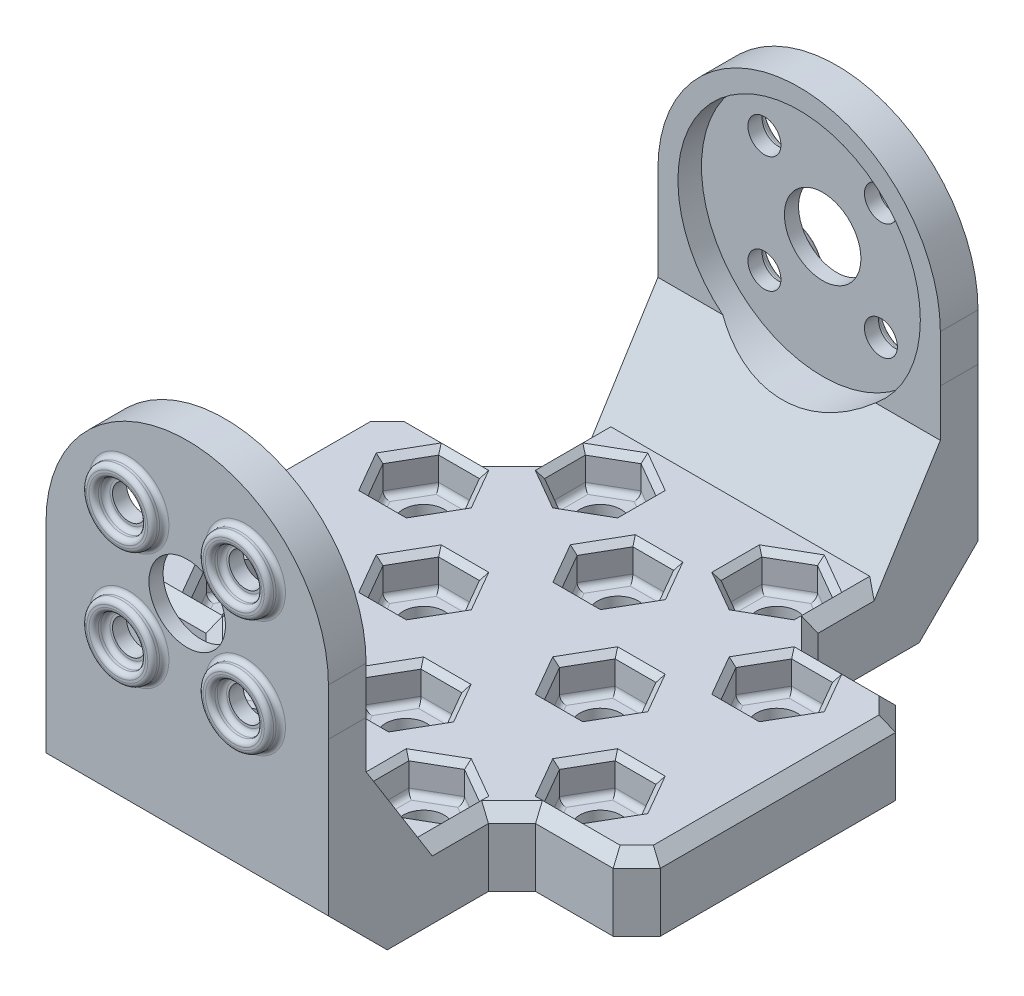
from build123d import *

# Parameters (mm, degrees)
SKETCH_1_R          = 3.25
SKETCH_1_R_2        = 1.4
EXTRUDE_1_DEPTH     = 3.2
SKETCH_2_W          = 24
SKETCH_2_H          = 6
EXTRUDE_2_DEPTH     = 48.8
SKETCH_3_R          = 1.4
SKETCH_3_R_2        = 3.25
EXTRUDE_3_DEPTH     = 3.2
SKETCH_4_R          = 10.3
CUT_EXTRUDE_1_DEPTH = 2
CUT_EXTRUDE_START   = -2
SKETCH_5_R          = 10.3
CUT_EXTRUDE_2_DEPTH = 2
CHAMFER_1_SIZE      = 5
SKETCH_6_R          = 3
SKETCH_6_R_2        = 2
EXTRUDE_4_DEPTH     = 1
EXTRUDE_START       = 1
SKETCH_7_R          = 3
SKETCH_7_R_2        = 2
EXTRUDE_5_DEPTH     = 1
FILLET_1_R          = 0.4
CHAMFER_4_SIZE      = 5
CHAMFER_4_SIZE_2    = 8
CHAMFER_5_SIZE      = 5
CHAMFER_5_SIZE_2    = 8
SKETCH_8_W          = 10.6001
SKETCH_8_H          = 24
EXTRUDE_6_DEPTH     = 6
CHAMFER_6_SIZE      = 2
CHAMFER_7_SIZE      = 1
SKETCH_9_R          = 1.75
CUT_EXTRUDE_3_DEPTH = 6
CUT_EXTRUDE_4_DEPTH = 3
CHAMFER_8_SIZE      = 0.5
FILLET_2_R          = 0.5


# Some blends are built 0.0001 mm under size
with BuildPart() as part:
    # Эскиз1 → Бобышка-Вытянуть1 (new body)
    with BuildSketch(Plane.XY):
        with BuildLine():
            Line((-11.9999, -22), (-11.9999, -16))
            Line((-11.9999, -16), (-12, -7.5e-05))
            ThreePointArc((-12, -7.5e-05), (-0.000187494, 11.999999999), (11.999999996, 0.000299989))
            Line((11.999999996, 0.000299989), (12.0001, -4))
            Line((12.0001, -4), (12.0001, -22))
            Line((12.0001, -22), (-11.9999, -22))
        make_face()
        Circle(SKETCH_1_R, mode=Mode.SUBTRACT)
        with Locations((-4.949747468, 4.949747468)):
            Circle(SKETCH_1_R_2, mode=Mode.SUBTRACT)
        with Locations((4.949747468, 4.949747468)):
            Circle(SKETCH_1_R_2, mode=Mode.SUBTRACT)
        with Locations((4.949747468, -4.949747468)):
            Circle(SKETCH_1_R_2, mode=Mode.SUBTRACT)
        with Locations((-4.949747468, -4.949747468)):
            Circle(SKETCH_1_R_2, mode=Mode.SUBTRACT)
    extrude(amount=EXTRUDE_1_DEPTH)

    # Эскиз2 → Бобышка-Вытянуть2 (add)
    with BuildSketch(Plane.XY.offset(3.2)):
        with Locations((0.0001, -19)):
            Rectangle(SKETCH_2_W, SKETCH_2_H)
    extrude(amount=EXTRUDE_2_DEPTH)

    # Эскиз3 → Бобышка-Вытянуть3 (add)
    with BuildSketch(Plane.XY.offset(52)):
        with BuildLine():
            Line((-11.9999, -22), (12.0001, -22))
            Line((12.0001, -22), (12.0001, -4))
            Line((12.0001, -4), (11.999999996, 0.000299989))
            ThreePointArc((11.999999996, 0.000299989), (-0.000187494, 11.999999999), (-12, -7.5e-05))
            Line((-12, -7.5e-05), (-11.9999, -16))
            Line((-11.9999, -16), (-11.9999, -22))
        make_face()
        with Locations((-4.949747468, 4.949747468)):
            Circle(SKETCH_3_R, mode=Mode.SUBTRACT)
        Circle(SKETCH_3_R_2, mode=Mode.SUBTRACT)
        with Locations((-4.949747468, -4.949747468)):
            Circle(SKETCH_3_R, mode=Mode.SUBTRACT)
        with Locations((4.949747468, -4.949747468)):
            Circle(SKETCH_3_R, mode=Mode.SUBTRACT)
        with Locations((4.949747468, 4.949747468)):
            Circle(SKETCH_3_R, mode=Mode.SUBTRACT)
    extrude(amount=EXTRUDE_3_DEPTH)

    # Эскиз4 → Вырез-Вытянуть1 (cut)
    with BuildSketch(Plane.XY.offset(3.2)):
        Circle(SKETCH_4_R)
    extrude(amount=-CUT_EXTRUDE_1_DEPTH, mode=Mode.SUBTRACT)

    # Эскиз5 → Вырез-Вытянуть2 (cut)
    with BuildSketch(Plane(origin=(0, 0, 52), x_dir=(-1, 0, 0), z_dir=(0, 0, -1)).offset(CUT_EXTRUDE_START)):
        with Locations(Location((0, 0, 0), (0, 0, 180))):
            Circle(SKETCH_5_R)
    extrude(amount=CUT_EXTRUDE_2_DEPTH, mode=Mode.SUBTRACT)

    # Фаска1
    chamfer_1_edges = [part.edges().sort_by_distance(p)[0] for p in [
        (0.0001, -22, 55.2),
        (0.0001, -22, 0),
    ]]
    chamfer(chamfer_1_edges, length=CHAMFER_1_SIZE)

    # Эскиз6 → Бобышка-Вытянуть4 (add)
    # profile 1 of 4: a face of its own
    with BuildSketch(Plane.XY.offset(55.2)):
        with Locations((-4.949747468, 4.949747468)):
            Circle(SKETCH_6_R)
        with Locations((-4.949747468, 4.949747468)):
            Circle(SKETCH_6_R_2, mode=Mode.SUBTRACT)
    # profile 2 of 4: a face of its own
    with BuildSketch(Plane.XY.offset(55.2)):
        with Locations((4.949747468, -4.949747468)):
            Circle(SKETCH_6_R)
        with Locations((4.949747468, -4.949747468)):
            Circle(SKETCH_6_R_2, mode=Mode.SUBTRACT)
    # profile 3 of 4: a face of its own
    with BuildSketch(Plane.XY.offset(55.2)):
        with Locations((-4.949747468, -4.949747468)):
            Circle(SKETCH_6_R)
        with Locations((-4.949747468, -4.949747468)):
            Circle(SKETCH_6_R_2, mode=Mode.SUBTRACT)
    # profile 4 of 4: a face of its own
    with BuildSketch(Plane.XY.offset(55.2)):
        with Locations((4.949747468, 4.949747468)):
            Circle(SKETCH_6_R)
        with Locations((4.949747468, 4.949747468)):
            Circle(SKETCH_6_R_2, mode=Mode.SUBTRACT)
    extrude(amount=EXTRUDE_4_DEPTH)

    # Эскиз7 → Бобышка-Вытянуть5 (add)
    # profile 1 of 4: a face of its own
    with BuildSketch(Plane(origin=(0, 0, 0), x_dir=(-1, 0, 0), z_dir=(0, 0, -1)).offset(EXTRUDE_START)):
        with Locations(Location((4.949747468, -4.949747468, 0), (0, 0, 180))):
            Circle(SKETCH_7_R)
        with Locations(Location((4.949747468, -4.949747468, 0), (0, 0, 180))):
            Circle(SKETCH_7_R_2, mode=Mode.SUBTRACT)
    # profile 2 of 4: a face of its own
    with BuildSketch(Plane(origin=(0, 0, 0), x_dir=(-1, 0, 0), z_dir=(0, 0, -1)).offset(EXTRUDE_START)):
        with Locations(Location((4.949747468, 4.949747468, 0), (0, 0, 180))):
            Circle(SKETCH_7_R)
        with Locations(Location((4.949747468, 4.949747468, 0), (0, 0, 180))):
            Circle(SKETCH_7_R_2, mode=Mode.SUBTRACT)
    # profile 3 of 4: a face of its own
    with BuildSketch(Plane(origin=(0, 0, 0), x_dir=(-1, 0, 0), z_dir=(0, 0, -1)).offset(EXTRUDE_START)):
        with Locations(Location((-4.949747468, 4.949747468, 0), (0, 0, 180))):
            Circle(SKETCH_7_R)
        with Locations(Location((-4.949747468, 4.949747468, 0), (0, 0, 180))):
            Circle(SKETCH_7_R_2, mode=Mode.SUBTRACT)
    # profile 4 of 4: a face of its own
    with BuildSketch(Plane(origin=(0, 0, 0), x_dir=(-1, 0, 0), z_dir=(0, 0, -1)).offset(EXTRUDE_START)):
        with Locations(Location((-4.949747468, -4.949747468, 0), (0, 0, 180))):
            Circle(SKETCH_7_R)
        with Locations(Location((-4.949747468, -4.949747468, 0), (0, 0, 180))):
            Circle(SKETCH_7_R_2, mode=Mode.SUBTRACT)
    extrude(amount=-EXTRUDE_5_DEPTH)

    # Скругление1
    fillet_1_edges = [part.edges().sort_by_distance(p)[0] for p in [
        (-6.949747468, 4.949747468, 55.2),
        (-7.949747468, 4.949747468, 56.2),
        (-7.949747468, 4.949747468, 55.2),
        (-6.949747468, 4.949747468, 56.2),
        (2.949747468, -4.949747468, 55.2),
        (1.949747468, -4.949747468, 56.2),
        (1.949747468, -4.949747468, 55.2),
        (2.949747468, -4.949747468, 56.2),
        (-6.949747468, -4.949747468, 55.2),
        (-7.949747468, -4.949747468, 56.2),
        (-7.949747468, -4.949747468, 55.2),
        (-6.949747468, -4.949747468, 56.2),
        (2.949747468, 4.949747468, 55.2),
        (1.949747468, 4.949747468, 56.2),
        (1.949747468, 4.949747468, 55.2),
        (2.949747468, 4.949747468, 56.2),
        (-7.949747468, -4.949747468, 0),
        (-7.949747468, -4.949747468, -1),
        (-6.949747468, -4.949747468, 0),
        (-6.949747468, -4.949747468, -1),
        (-7.949747468, 4.949747468, 0),
        (-7.949747468, 4.949747468, -1),
        (-6.949747468, 4.949747468, 0),
        (-6.949747468, 4.949747468, -1),
        (1.949747468, 4.949747468, 0),
        (1.949747468, 4.949747468, -1),
        (2.949747468, 4.949747468, 0),
        (2.949747468, 4.949747468, -1),
        (1.949747468, -4.949747468, 0),
        (1.949747468, -4.949747468, -1),
        (2.949747468, -4.949747468, 0),
        (2.949747468, -4.949747468, -1),
    ]]
    fillet(fillet_1_edges, radius=FILLET_1_R)

    # Фаска4
    # the kernel refuses this chamfer: 8, 5 mm, written as the material it adds along each edge
    with BuildSketch(Plane(origin=(-32.682645121, -16, 3.2), x_dir=(0, -0.05241922030434533, 0.9986251675892635), z_dir=(1, 0, 0))) as chamfer_4_piece_1_section:
        Polygon((CHAMFER_4_SIZE * 0.998625167589, -CHAMFER_4_SIZE * 0.0524192203043), (-CHAMFER_4_SIZE_2 * 0.0524192203043, -CHAMFER_4_SIZE_2 * 0.998625167589), (0, 0), align=None)
    chamfer_4_piece_1 = extrude(amount=44.682745121, mode=Mode.PRIVATE)
    chamfer_4_piece_1 = split(chamfer_4_piece_1, bisect_by=Plane(origin=(-11.999925, -11.999995619, 4.449998631), z_dir=(0.9999999999804687, 6.2500146490708725e-06, 0)), keep=Keep.TOP, mode=Mode.PRIVATE)
    chamfer_4_piece_1 = chamfer_4_piece_1 - Plane(origin=(0, 0, 4.449998631), x_dir=(1, 0, 0), z_dir=(0, 0, 1)) * Cylinder(10.3, 122, mode=Mode.PRIVATE)
    add(chamfer_4_piece_1)

    # Фаска5
    # the kernel refuses this chamfer: 8, 5 mm, written as the material it adds along each edge
    with BuildSketch(Plane(origin=(-32.682645121, -16, 52), x_dir=(0, -0.0524192203043453, -0.9986251675892635), z_dir=(1, 0, 0))) as chamfer_5_piece_1_section:
        Polygon((CHAMFER_5_SIZE * 0.998625167589, CHAMFER_5_SIZE * 0.0524192203043), (-CHAMFER_5_SIZE_2 * 0.0524192203043, CHAMFER_5_SIZE_2 * 0.998625167589), (0, 0), align=None)
    chamfer_5_piece_1 = extrude(amount=44.682745121, mode=Mode.PRIVATE)
    chamfer_5_piece_1 = split(chamfer_5_piece_1, bisect_by=Plane(origin=(-11.999925, -12.000007302, 50.749997718), z_dir=(0.9999999999804687, 6.2500146490708725e-06, 0)), keep=Keep.TOP, mode=Mode.PRIVATE)
    chamfer_5_piece_1 = chamfer_5_piece_1 - Plane(origin=(0, 0, 50.749997718), x_dir=(1, 0, 0), z_dir=(0, 0, 1)) * Cylinder(10.3, 122, mode=Mode.PRIVATE)
    add(chamfer_5_piece_1)

    # Эскиз8 → Бобышка-Вытянуть6 (add)
    with BuildSketch(Plane.XZ.offset(22)):
        with Locations((-17.29995, 27.6)):
            Rectangle(SKETCH_8_W, SKETCH_8_H)
        with Locations((17.30015, 27.6)):
            Rectangle(SKETCH_8_W, SKETCH_8_H)
    extrude(amount=-EXTRUDE_6_DEPTH)

    # Фаска6
    chamfer_6_edges = [part.edges().sort_by_distance(p)[0] for p in [
        (12.0001, -19, 39.6),
        (12.0001, -19, 15.6),
        (-11.9999, -19, 15.6),
        (-11.9999, -19, 39.6),
        (-22.6, -19, 39.6),
        (-22.6, -19, 15.6),
        (22.6002, -19, 15.6),
        (22.6002, -19, 39.6),
    ]]
    chamfer(chamfer_6_edges, length=CHAMFER_6_SIZE)

    # Фаска7
    # the kernel refuses this chamfer: 1 mm, written as the material it takes off along each edge
    with BuildSketch(Plane(origin=(12.0001, -16, 39.028317012), x_dir=(-0.9996219169112968, 0.027495876610585647, 0), z_dir=(0, 0, 1))) as chamfer_7_piece_1_section:
        Polygon((CHAMFER_7_SIZE * 0.999621916911, CHAMFER_7_SIZE * 0.0274958766106), (-CHAMFER_7_SIZE * 0.0274958766106, CHAMFER_7_SIZE * 0.999621916911), (0, 0), align=None)
    chamfer_7_piece_1 = extrude(amount=10.543365976, mode=Mode.PRIVATE)
    chamfer_7_piece_1 = split(chamfer_7_piece_1, bisect_by=Plane(origin=(11.678999598, -17.42378565, 46.110133969), z_dir=(0, 0.5299989400034341, -0.8479983040049294)), keep=Keep.TOP, mode=Mode.PRIVATE)
    chamfer_7_piece_1 = split(chamfer_7_piece_1, bisect_by=Plane(origin=(10.460620554, -16.328613475, 43.139479446), z_dir=(0.7071067811865476, 0, 0.7071067811865476)), keep=Keep.TOP, mode=Mode.PRIVATE)
    add(chamfer_7_piece_1, mode=Mode.SUBTRACT)
    with BuildSketch(Plane(origin=(-11.9999, -16, 39.028317012), x_dir=(0.9996219169112968, 0.027495876610585647, 0), z_dir=(0, 0, 1))) as chamfer_7_piece_2_section:
        Polygon((CHAMFER_7_SIZE * 0.999621916911, -CHAMFER_7_SIZE * 0.0274958766106), (-CHAMFER_7_SIZE * 0.0274958766106, -CHAMFER_7_SIZE * 0.999621916911), (0, 0), align=None)
    chamfer_7_piece_2 = extrude(amount=10.543365976, mode=Mode.PRIVATE)
    chamfer_7_piece_2 = split(chamfer_7_piece_2, bisect_by=Plane(origin=(-11.678799598, -17.42378565, 46.110133969), z_dir=(0, 0.5299989400034341, -0.8479983040049294)), keep=Keep.TOP, mode=Mode.PRIVATE)
    chamfer_7_piece_2 = split(chamfer_7_piece_2, bisect_by=Plane(origin=(-10.460420554, -16.328613475, 43.139479446), z_dir=(-0.7071067811865476, 0, 0.7071067811865476)), keep=Keep.TOP, mode=Mode.PRIVATE)
    add(chamfer_7_piece_2, mode=Mode.SUBTRACT)
    with BuildSketch(Plane(origin=(11.428417012, -16, 39.6), x_dir=(0, 0.02749587661058555, -0.9996219169112968), z_dir=(1, 0, 0))) as chamfer_7_piece_3_section:
        Polygon((CHAMFER_7_SIZE * 0.999621916911, -CHAMFER_7_SIZE * 0.0274958766106), (-CHAMFER_7_SIZE * 0.0274958766106, -CHAMFER_7_SIZE * 0.999621916911), (0, 0), align=None)
    chamfer_7_piece_3 = extrude(amount=11.743465976, mode=Mode.PRIVATE)
    chamfer_7_piece_3 = split(chamfer_7_piece_3, bisect_by=Plane(origin=(16.53500452, -16.333633117, 37.06509548), z_dir=(0.7071067811865476, 0, 0.7071067811865476)), keep=Keep.TOP, mode=Mode.PRIVATE)
    add(chamfer_7_piece_3, mode=Mode.SUBTRACT)
    with BuildSketch(Plane(origin=(12.0001, -16, 5.628317012), x_dir=(-0.9996219169112968, 0.027495876610585647, 0), z_dir=(0, 0, 1))) as chamfer_7_piece_4_section:
        Polygon((CHAMFER_7_SIZE * 0.999621916911, CHAMFER_7_SIZE * 0.0274958766106), (-CHAMFER_7_SIZE * 0.0274958766106, CHAMFER_7_SIZE * 0.999621916911), (0, 0), align=None)
    chamfer_7_piece_4 = extrude(amount=10.543365976, mode=Mode.PRIVATE)
    chamfer_7_piece_4 = split(chamfer_7_piece_4, bisect_by=Plane(origin=(11.678999598, -17.42378565, 9.089866031), z_dir=(0, 0.529998940003434, 0.8479983040049293)), keep=Keep.TOP, mode=Mode.PRIVATE)
    chamfer_7_piece_4 = split(chamfer_7_piece_4, bisect_by=Plane(origin=(10.460620554, -16.328613475, 12.060520554), z_dir=(0.7071067811865476, 0, -0.7071067811865476)), keep=Keep.TOP, mode=Mode.PRIVATE)
    add(chamfer_7_piece_4, mode=Mode.SUBTRACT)
    with BuildSketch(Plane(origin=(23.171882988, -16, 15.6), x_dir=(0, 0.027495876610585647, 0.9996219169112968), z_dir=(-1, 0, 0))) as chamfer_7_piece_5_section:
        Polygon((CHAMFER_7_SIZE * 0.999621916911, -CHAMFER_7_SIZE * 0.0274958766106), (-CHAMFER_7_SIZE * 0.0274958766106, -CHAMFER_7_SIZE * 0.999621916911), (0, 0), align=None)
    chamfer_7_piece_5 = extrude(amount=11.743465976, mode=Mode.PRIVATE)
    chamfer_7_piece_5 = split(chamfer_7_piece_5, bisect_by=Plane(origin=(16.53500452, -16.333633117, 18.13490452), z_dir=(0.7071067811865476, 0, -0.7071067811865476)), keep=Keep.TOP, mode=Mode.PRIVATE)
    add(chamfer_7_piece_5, mode=Mode.SUBTRACT)
    with BuildSketch(Plane(origin=(-23.171682988, -16, 15.6), x_dir=(0, 0.027495876610585647, 0.9996219169112968), z_dir=(1, 0, 0))) as chamfer_7_piece_6_section:
        Polygon((CHAMFER_7_SIZE * 0.999621916911, CHAMFER_7_SIZE * 0.0274958766106), (-CHAMFER_7_SIZE * 0.0274958766106, CHAMFER_7_SIZE * 0.999621916911), (0, 0), align=None)
    chamfer_7_piece_6 = extrude(amount=11.743465976, mode=Mode.PRIVATE)
    chamfer_7_piece_6 = split(chamfer_7_piece_6, bisect_by=Plane(origin=(-16.53480452, -16.333633117, 18.13490452), z_dir=(-0.7071067811865476, 0, -0.7071067811865476)), keep=Keep.TOP, mode=Mode.PRIVATE)
    add(chamfer_7_piece_6, mode=Mode.SUBTRACT)
    with BuildSketch(Plane(origin=(-11.9999, -16, 5.628317012), x_dir=(0.9996219169112968, 0.027495876610585647, 0), z_dir=(0, 0, 1))) as chamfer_7_piece_7_section:
        Polygon((CHAMFER_7_SIZE * 0.999621916911, -CHAMFER_7_SIZE * 0.0274958766106), (-CHAMFER_7_SIZE * 0.0274958766106, -CHAMFER_7_SIZE * 0.999621916911), (0, 0), align=None)
    chamfer_7_piece_7 = extrude(amount=10.543365976, mode=Mode.PRIVATE)
    chamfer_7_piece_7 = split(chamfer_7_piece_7, bisect_by=Plane(origin=(-11.678799598, -17.42378565, 9.089866031), z_dir=(0, 0.529998940003434, 0.8479983040049293)), keep=Keep.TOP, mode=Mode.PRIVATE)
    chamfer_7_piece_7 = split(chamfer_7_piece_7, bisect_by=Plane(origin=(-10.460420554, -16.328613475, 12.060520554), z_dir=(-0.7071067811865476, 0, -0.7071067811865476)), keep=Keep.TOP, mode=Mode.PRIVATE)
    add(chamfer_7_piece_7, mode=Mode.SUBTRACT)
    with BuildSketch(Plane(origin=(-11.428217012, -16, 39.6), x_dir=(0, 0.02749587661058555, -0.9996219169112968), z_dir=(-1, 0, 0))) as chamfer_7_piece_8_section:
        Polygon((CHAMFER_7_SIZE * 0.999621916911, CHAMFER_7_SIZE * 0.0274958766106), (-CHAMFER_7_SIZE * 0.0274958766106, CHAMFER_7_SIZE * 0.999621916911), (0, 0), align=None)
    chamfer_7_piece_8 = extrude(amount=11.743465976, mode=Mode.PRIVATE)
    chamfer_7_piece_8 = split(chamfer_7_piece_8, bisect_by=Plane(origin=(-16.53480452, -16.333633117, 37.06509548), z_dir=(-0.7071067811865476, 0, 0.7071067811865476)), keep=Keep.TOP, mode=Mode.PRIVATE)
    add(chamfer_7_piece_8, mode=Mode.SUBTRACT)
    with BuildSketch(Plane(origin=(-22.6, -16, 40.171682988), x_dir=(0.9996219169112968, 0.027495876610585647, 0), z_dir=(0, 0, -1))) as chamfer_7_piece_9:
        Polygon((CHAMFER_7_SIZE * 0.999621916911, CHAMFER_7_SIZE * 0.0274958766106), (-CHAMFER_7_SIZE * 0.0274958766106, CHAMFER_7_SIZE * 0.999621916911), (0, 0), align=None)
    extrude(amount=25.143365976, mode=Mode.SUBTRACT)
    with BuildSketch(Plane(origin=(22.6002, -16, 40.171682988), x_dir=(-0.9996219169112968, 0.027495876610585647, 0), z_dir=(0, 0, -1))) as chamfer_7_piece_10:
        Polygon((CHAMFER_7_SIZE * 0.999621916911, -CHAMFER_7_SIZE * 0.0274958766106), (-CHAMFER_7_SIZE * 0.0274958766106, -CHAMFER_7_SIZE * 0.999621916911), (0, 0), align=None)
    extrude(amount=25.143365976, mode=Mode.SUBTRACT)
    with BuildSketch(Plane(origin=(18.78174552, -16, 41.41845448), x_dir=(-0.7068394360706735, 0.02749587661058563, -0.7068394360706735), z_dir=(0.7071067811865476, 0, -0.7071067811865476)), Plane(origin=(-18.78154552, -16, 13.78154552), x_dir=(0.7068394360706736, 0.0274958766105857, 0.7068394360706736), z_dir=(-0.7071067811865476, 0, 0.7071067811865476))) as chamfer_7_piece_11:
        Polygon((CHAMFER_7_SIZE * 0.999621916911, -CHAMFER_7_SIZE * 0.0274958766106), (-CHAMFER_7_SIZE * 0.0274958766106, -CHAMFER_7_SIZE * 0.999621916911), (0, 0), align=None)
    extrude(amount=7.971793101, mode=Mode.SUBTRACT)
    with BuildSketch(Plane(origin=(18.78174552, -16, 13.78154552), x_dir=(-0.7068394360706738, 0.027495876610585696, 0.7068394360706731), z_dir=(0.7071067811865472, 0, 0.7071067811865479)), Plane(origin=(-18.78154552, -16, 41.41845448), x_dir=(0.7068394360706735, 0.02749587661058563, -0.7068394360706735), z_dir=(-0.7071067811865476, 0, -0.7071067811865476))) as chamfer_7_piece_12:
        Polygon((CHAMFER_7_SIZE * 0.999621916911, CHAMFER_7_SIZE * 0.0274958766106), (-CHAMFER_7_SIZE * 0.0274958766106, CHAMFER_7_SIZE * 0.999621916911), (0, 0), align=None)
    extrude(amount=7.971793101, mode=Mode.SUBTRACT)
    with BuildSketch(Plane(origin=(10.18164552, -16, 43.41845448), x_dir=(-0.7068394360706735, 0.02749587661058563, -0.7068394360706735), z_dir=(0.7071067811865476, 0, -0.7071067811865476))) as chamfer_7_piece_13_section:
        Polygon((CHAMFER_7_SIZE * 0.999621916911, -CHAMFER_7_SIZE * 0.0274958766106), (-CHAMFER_7_SIZE * 0.0274958766106, -CHAMFER_7_SIZE * 0.999621916911), (0, 0), align=None)
    chamfer_7_piece_13 = extrude(amount=7.971793101, mode=Mode.PRIVATE)
    chamfer_7_piece_13 = split(chamfer_7_piece_13, bisect_by=Plane(origin=(12.0001, -16.361099518, 40.408208154), z_dir=(1, 0, 0)), keep=Keep.TOP, mode=Mode.PRIVATE)
    chamfer_7_piece_13 = split(chamfer_7_piece_13, bisect_by=Plane(origin=(12.808308154, -16.361099518, 39.6), z_dir=(0, 0, 1)), keep=Keep.TOP, mode=Mode.PRIVATE)
    add(chamfer_7_piece_13, mode=Mode.SUBTRACT)
    with BuildSketch(Plane(origin=(10.18164552, -16, 11.78154552), x_dir=(-0.7068394360706735, 0.02749587661058563, 0.7068394360706735), z_dir=(0.7071067811865476, 0, 0.7071067811865476))) as chamfer_7_piece_14_section:
        Polygon((CHAMFER_7_SIZE * 0.999621916911, CHAMFER_7_SIZE * 0.0274958766106), (-CHAMFER_7_SIZE * 0.0274958766106, CHAMFER_7_SIZE * 0.999621916911), (0, 0), align=None)
    chamfer_7_piece_14 = extrude(amount=7.971793101, mode=Mode.PRIVATE)
    chamfer_7_piece_14 = split(chamfer_7_piece_14, bisect_by=Plane(origin=(12.0001, -16.361099518, 14.791791846), z_dir=(1, 0, 0)), keep=Keep.TOP, mode=Mode.PRIVATE)
    chamfer_7_piece_14 = split(chamfer_7_piece_14, bisect_by=Plane(origin=(12.808308154, -16.361099518, 15.6), z_dir=(0, 0, -1)), keep=Keep.TOP, mode=Mode.PRIVATE)
    add(chamfer_7_piece_14, mode=Mode.SUBTRACT)
    with BuildSketch(Plane(origin=(-10.18144552, -16, 11.78154552), x_dir=(0.7068394360706736, 0.027495876610585664, 0.7068394360706736), z_dir=(-0.7071067811865476, 0, 0.7071067811865476))) as chamfer_7_piece_15_section:
        Polygon((CHAMFER_7_SIZE * 0.999621916911, -CHAMFER_7_SIZE * 0.0274958766106), (-CHAMFER_7_SIZE * 0.0274958766106, -CHAMFER_7_SIZE * 0.999621916911), (0, 0), align=None)
    chamfer_7_piece_15 = extrude(amount=7.971793101, mode=Mode.PRIVATE)
    chamfer_7_piece_15 = split(chamfer_7_piece_15, bisect_by=Plane(origin=(-11.9999, -16.361099518, 14.791791846), z_dir=(-1, 0, 0)), keep=Keep.TOP, mode=Mode.PRIVATE)
    chamfer_7_piece_15 = split(chamfer_7_piece_15, bisect_by=Plane(origin=(-12.808108154, -16.361099518, 15.6), z_dir=(0, 0, -1)), keep=Keep.TOP, mode=Mode.PRIVATE)
    add(chamfer_7_piece_15, mode=Mode.SUBTRACT)
    with BuildSketch(Plane(origin=(-10.18144552, -16, 43.41845448), x_dir=(0.7068394360706736, 0.0274958766105856, -0.7068394360706736), z_dir=(-0.7071067811865476, 0, -0.7071067811865476))) as chamfer_7_piece_16_section:
        Polygon((CHAMFER_7_SIZE * 0.999621916911, CHAMFER_7_SIZE * 0.0274958766106), (-CHAMFER_7_SIZE * 0.0274958766106, CHAMFER_7_SIZE * 0.999621916911), (0, 0), align=None)
    chamfer_7_piece_16 = extrude(amount=7.971793101, mode=Mode.PRIVATE)
    chamfer_7_piece_16 = split(chamfer_7_piece_16, bisect_by=Plane(origin=(-11.9999, -16.361099518, 40.408208154), z_dir=(-1, 0, 0)), keep=Keep.TOP, mode=Mode.PRIVATE)
    chamfer_7_piece_16 = split(chamfer_7_piece_16, bisect_by=Plane(origin=(-12.808108154, -16.361099518, 39.6), z_dir=(0, 0, 1)), keep=Keep.TOP, mode=Mode.PRIVATE)
    add(chamfer_7_piece_16, mode=Mode.SUBTRACT)
    with BuildSketch(Plane(origin=(12.0001, -16, 39.028317012), x_dir=(-0.9996219169112968, 0.027495876610585647, 0), z_dir=(0, 0, 1))) as chamfer_7_piece_17a_section:
        Polygon((CHAMFER_7_SIZE * 0.999621916911, CHAMFER_7_SIZE * 0.0274958766106), (-CHAMFER_7_SIZE * 0.0274958766106, CHAMFER_7_SIZE * 0.999621916911), (0, 0), align=None)
    chamfer_7_piece_17a = extrude(amount=10.543365976, mode=Mode.PRIVATE)
    chamfer_7_piece_17a = split(chamfer_7_piece_17a, bisect_by=Plane(origin=(12.379260813, -16.318093125, 41.220839187), z_dir=(-0.7071067811865476, 0, -0.7071067811865476)), keep=Keep.TOP, mode=Mode.PRIVATE)
    with BuildSketch(Plane(origin=(10.18164552, -16, 43.41845448), x_dir=(-0.7068394360706735, 0.02749587661058563, -0.7068394360706735), z_dir=(0.7071067811865476, 0, -0.7071067811865476))) as chamfer_7_piece_17b_section:
        Polygon((CHAMFER_7_SIZE * 0.999621916911, -CHAMFER_7_SIZE * 0.0274958766106), (-CHAMFER_7_SIZE * 0.0274958766106, -CHAMFER_7_SIZE * 0.999621916911), (0, 0), align=None)
    chamfer_7_piece_17b = extrude(amount=7.971793101, mode=Mode.PRIVATE)
    chamfer_7_piece_17b = split(chamfer_7_piece_17b, bisect_by=Plane(origin=(12.0001, -16.318093125, 42.136214365), z_dir=(-1, 0, 0)), keep=Keep.TOP, mode=Mode.PRIVATE)
    chamfer_7_piece_17 = chamfer_7_piece_17a & chamfer_7_piece_17b
    add(chamfer_7_piece_17, mode=Mode.SUBTRACT)
    with BuildSketch(Plane(origin=(-10.18144552, -16, 43.41845448), x_dir=(0.7068394360706736, 0.0274958766105856, -0.7068394360706736), z_dir=(-0.7071067811865476, 0, -0.7071067811865476))) as chamfer_7_piece_18a_section:
        Polygon((CHAMFER_7_SIZE * 0.999621916911, CHAMFER_7_SIZE * 0.0274958766106), (-CHAMFER_7_SIZE * 0.0274958766106, CHAMFER_7_SIZE * 0.999621916911), (0, 0), align=None)
    chamfer_7_piece_18a = extrude(amount=7.971793101, mode=Mode.PRIVATE)
    chamfer_7_piece_18a = split(chamfer_7_piece_18a, bisect_by=Plane(origin=(-11.9999, -16.318093125, 42.136214365), z_dir=(1, 0, 0)), keep=Keep.TOP, mode=Mode.PRIVATE)
    with BuildSketch(Plane(origin=(-11.9999, -16, 39.028317012), x_dir=(0.9996219169112968, 0.027495876610585647, 0), z_dir=(0, 0, 1))) as chamfer_7_piece_18b_section:
        Polygon((CHAMFER_7_SIZE * 0.999621916911, -CHAMFER_7_SIZE * 0.0274958766106), (-CHAMFER_7_SIZE * 0.0274958766106, -CHAMFER_7_SIZE * 0.999621916911), (0, 0), align=None)
    chamfer_7_piece_18b = extrude(amount=10.543365976, mode=Mode.PRIVATE)
    chamfer_7_piece_18b = split(chamfer_7_piece_18b, bisect_by=Plane(origin=(-12.379060813, -16.318093125, 41.220839187), z_dir=(0.7071067811865476, 0, -0.7071067811865476)), keep=Keep.TOP, mode=Mode.PRIVATE)
    chamfer_7_piece_18 = chamfer_7_piece_18a & chamfer_7_piece_18b
    add(chamfer_7_piece_18, mode=Mode.SUBTRACT)
    with BuildSketch(Plane(origin=(10.18164552, -16, 43.41845448), x_dir=(-0.7068394360706735, 0.02749587661058563, -0.7068394360706735), z_dir=(0.7071067811865476, 0, -0.7071067811865476))) as chamfer_7_piece_19a_section:
        Polygon((CHAMFER_7_SIZE * 0.999621916911, -CHAMFER_7_SIZE * 0.0274958766106), (-CHAMFER_7_SIZE * 0.0274958766106, -CHAMFER_7_SIZE * 0.999621916911), (0, 0), align=None)
    chamfer_7_piece_19a = extrude(amount=7.971793101, mode=Mode.PRIVATE)
    chamfer_7_piece_19a = split(chamfer_7_piece_19a, bisect_by=Plane(origin=(14.536314365, -16.318093125, 39.6), z_dir=(0, 0, -1)), keep=Keep.TOP, mode=Mode.PRIVATE)
    with BuildSketch(Plane(origin=(11.428417012, -16, 39.6), x_dir=(0, 0.02749587661058555, -0.9996219169112968), z_dir=(1, 0, 0))) as chamfer_7_piece_19b_section:
        Polygon((CHAMFER_7_SIZE * 0.999621916911, -CHAMFER_7_SIZE * 0.0274958766106), (-CHAMFER_7_SIZE * 0.0274958766106, -CHAMFER_7_SIZE * 0.999621916911), (0, 0), align=None)
    chamfer_7_piece_19b = extrude(amount=11.743465976, mode=Mode.PRIVATE)
    chamfer_7_piece_19b = split(chamfer_7_piece_19b, bisect_by=Plane(origin=(13.620939187, -16.318093125, 39.979160813), z_dir=(-0.7071067811865476, 0, -0.7071067811865476)), keep=Keep.TOP, mode=Mode.PRIVATE)
    chamfer_7_piece_19 = chamfer_7_piece_19a & chamfer_7_piece_19b
    add(chamfer_7_piece_19, mode=Mode.SUBTRACT)
    with BuildSketch(Plane(origin=(12.0001, -16, 5.628317012), x_dir=(-0.9996219169112968, 0.027495876610585647, 0), z_dir=(0, 0, 1))) as chamfer_7_piece_20a_section:
        Polygon((CHAMFER_7_SIZE * 0.999621916911, CHAMFER_7_SIZE * 0.0274958766106), (-CHAMFER_7_SIZE * 0.0274958766106, CHAMFER_7_SIZE * 0.999621916911), (0, 0), align=None)
    chamfer_7_piece_20a = extrude(amount=10.543365976, mode=Mode.PRIVATE)
    chamfer_7_piece_20a = split(chamfer_7_piece_20a, bisect_by=Plane(origin=(12.379260813, -16.318093125, 13.979160813), z_dir=(-0.7071067811865476, 0, 0.7071067811865476)), keep=Keep.TOP, mode=Mode.PRIVATE)
    with BuildSketch(Plane(origin=(10.18164552, -16, 11.78154552), x_dir=(-0.7068394360706735, 0.02749587661058563, 0.7068394360706735), z_dir=(0.7071067811865476, 0, 0.7071067811865476))) as chamfer_7_piece_20b_section:
        Polygon((CHAMFER_7_SIZE * 0.999621916911, CHAMFER_7_SIZE * 0.0274958766106), (-CHAMFER_7_SIZE * 0.0274958766106, CHAMFER_7_SIZE * 0.999621916911), (0, 0), align=None)
    chamfer_7_piece_20b = extrude(amount=7.971793101, mode=Mode.PRIVATE)
    chamfer_7_piece_20b = split(chamfer_7_piece_20b, bisect_by=Plane(origin=(12.0001, -16.318093125, 13.063785635), z_dir=(-1, 0, 0)), keep=Keep.TOP, mode=Mode.PRIVATE)
    chamfer_7_piece_20 = chamfer_7_piece_20a & chamfer_7_piece_20b
    add(chamfer_7_piece_20, mode=Mode.SUBTRACT)
    with BuildSketch(Plane(origin=(23.171882988, -16, 15.6), x_dir=(0, 0.027495876610585647, 0.9996219169112968), z_dir=(-1, 0, 0))) as chamfer_7_piece_21a_section:
        Polygon((CHAMFER_7_SIZE * 0.999621916911, -CHAMFER_7_SIZE * 0.0274958766106), (-CHAMFER_7_SIZE * 0.0274958766106, -CHAMFER_7_SIZE * 0.999621916911), (0, 0), align=None)
    chamfer_7_piece_21a = extrude(amount=11.743465976, mode=Mode.PRIVATE)
    chamfer_7_piece_21a = split(chamfer_7_piece_21a, bisect_by=Plane(origin=(13.620939187, -16.318093125, 15.220839187), z_dir=(-0.7071067811865476, 0, 0.7071067811865476)), keep=Keep.TOP, mode=Mode.PRIVATE)
    with BuildSketch(Plane(origin=(10.18164552, -16, 11.78154552), x_dir=(-0.7068394360706735, 0.02749587661058563, 0.7068394360706735), z_dir=(0.7071067811865476, 0, 0.7071067811865476))) as chamfer_7_piece_21b_section:
        Polygon((CHAMFER_7_SIZE * 0.999621916911, CHAMFER_7_SIZE * 0.0274958766106), (-CHAMFER_7_SIZE * 0.0274958766106, CHAMFER_7_SIZE * 0.999621916911), (0, 0), align=None)
    chamfer_7_piece_21b = extrude(amount=7.971793101, mode=Mode.PRIVATE)
    chamfer_7_piece_21b = split(chamfer_7_piece_21b, bisect_by=Plane(origin=(14.536314365, -16.318093125, 15.6), z_dir=(0, 0, 1)), keep=Keep.TOP, mode=Mode.PRIVATE)
    chamfer_7_piece_21 = chamfer_7_piece_21a & chamfer_7_piece_21b
    add(chamfer_7_piece_21, mode=Mode.SUBTRACT)
    with BuildSketch(Plane(origin=(-10.18144552, -16, 11.78154552), x_dir=(0.7068394360706736, 0.027495876610585664, 0.7068394360706736), z_dir=(-0.7071067811865476, 0, 0.7071067811865476))) as chamfer_7_piece_22a_section:
        Polygon((CHAMFER_7_SIZE * 0.999621916911, -CHAMFER_7_SIZE * 0.0274958766106), (-CHAMFER_7_SIZE * 0.0274958766106, -CHAMFER_7_SIZE * 0.999621916911), (0, 0), align=None)
    chamfer_7_piece_22a = extrude(amount=7.971793101, mode=Mode.PRIVATE)
    chamfer_7_piece_22a = split(chamfer_7_piece_22a, bisect_by=Plane(origin=(-14.536114365, -16.318093125, 15.6), z_dir=(0, 0, 1)), keep=Keep.TOP, mode=Mode.PRIVATE)
    with BuildSketch(Plane(origin=(-23.171682988, -16, 15.6), x_dir=(0, 0.027495876610585647, 0.9996219169112968), z_dir=(1, 0, 0))) as chamfer_7_piece_22b_section:
        Polygon((CHAMFER_7_SIZE * 0.999621916911, CHAMFER_7_SIZE * 0.0274958766106), (-CHAMFER_7_SIZE * 0.0274958766106, CHAMFER_7_SIZE * 0.999621916911), (0, 0), align=None)
    chamfer_7_piece_22b = extrude(amount=11.743465976, mode=Mode.PRIVATE)
    chamfer_7_piece_22b = split(chamfer_7_piece_22b, bisect_by=Plane(origin=(-13.620739187, -16.318093125, 15.220839187), z_dir=(0.7071067811865476, 0, 0.7071067811865476)), keep=Keep.TOP, mode=Mode.PRIVATE)
    chamfer_7_piece_22 = chamfer_7_piece_22a & chamfer_7_piece_22b
    add(chamfer_7_piece_22, mode=Mode.SUBTRACT)
    with BuildSketch(Plane(origin=(-11.9999, -16, 5.628317012), x_dir=(0.9996219169112968, 0.027495876610585647, 0), z_dir=(0, 0, 1))) as chamfer_7_piece_23a_section:
        Polygon((CHAMFER_7_SIZE * 0.999621916911, -CHAMFER_7_SIZE * 0.0274958766106), (-CHAMFER_7_SIZE * 0.0274958766106, -CHAMFER_7_SIZE * 0.999621916911), (0, 0), align=None)
    chamfer_7_piece_23a = extrude(amount=10.543365976, mode=Mode.PRIVATE)
    chamfer_7_piece_23a = split(chamfer_7_piece_23a, bisect_by=Plane(origin=(-12.379060813, -16.318093125, 13.979160813), z_dir=(0.7071067811865476, 0, 0.7071067811865476)), keep=Keep.TOP, mode=Mode.PRIVATE)
    with BuildSketch(Plane(origin=(-10.18144552, -16, 11.78154552), x_dir=(0.7068394360706736, 0.027495876610585664, 0.7068394360706736), z_dir=(-0.7071067811865476, 0, 0.7071067811865476))) as chamfer_7_piece_23b_section:
        Polygon((CHAMFER_7_SIZE * 0.999621916911, -CHAMFER_7_SIZE * 0.0274958766106), (-CHAMFER_7_SIZE * 0.0274958766106, -CHAMFER_7_SIZE * 0.999621916911), (0, 0), align=None)
    chamfer_7_piece_23b = extrude(amount=7.971793101, mode=Mode.PRIVATE)
    chamfer_7_piece_23b = split(chamfer_7_piece_23b, bisect_by=Plane(origin=(-11.9999, -16.318093125, 13.063785635), z_dir=(1, 0, 0)), keep=Keep.TOP, mode=Mode.PRIVATE)
    chamfer_7_piece_23 = chamfer_7_piece_23a & chamfer_7_piece_23b
    add(chamfer_7_piece_23, mode=Mode.SUBTRACT)
    with BuildSketch(Plane(origin=(-11.428217012, -16, 39.6), x_dir=(0, 0.02749587661058555, -0.9996219169112968), z_dir=(-1, 0, 0))) as chamfer_7_piece_24a_section:
        Polygon((CHAMFER_7_SIZE * 0.999621916911, CHAMFER_7_SIZE * 0.0274958766106), (-CHAMFER_7_SIZE * 0.0274958766106, CHAMFER_7_SIZE * 0.999621916911), (0, 0), align=None)
    chamfer_7_piece_24a = extrude(amount=11.743465976, mode=Mode.PRIVATE)
    chamfer_7_piece_24a = split(chamfer_7_piece_24a, bisect_by=Plane(origin=(-13.620739187, -16.318093125, 39.979160813), z_dir=(0.7071067811865476, 0, -0.7071067811865476)), keep=Keep.TOP, mode=Mode.PRIVATE)
    with BuildSketch(Plane(origin=(-10.18144552, -16, 43.41845448), x_dir=(0.7068394360706736, 0.0274958766105856, -0.7068394360706736), z_dir=(-0.7071067811865476, 0, -0.7071067811865476))) as chamfer_7_piece_24b_section:
        Polygon((CHAMFER_7_SIZE * 0.999621916911, CHAMFER_7_SIZE * 0.0274958766106), (-CHAMFER_7_SIZE * 0.0274958766106, CHAMFER_7_SIZE * 0.999621916911), (0, 0), align=None)
    chamfer_7_piece_24b = extrude(amount=7.971793101, mode=Mode.PRIVATE)
    chamfer_7_piece_24b = split(chamfer_7_piece_24b, bisect_by=Plane(origin=(-14.536114365, -16.318093125, 39.6), z_dir=(0, 0, -1)), keep=Keep.TOP, mode=Mode.PRIVATE)
    chamfer_7_piece_24 = chamfer_7_piece_24a & chamfer_7_piece_24b
    add(chamfer_7_piece_24, mode=Mode.SUBTRACT)

    # Эскиз9 → Вырез-Вытянуть3 (cut)
    with BuildSketch(Plane(origin=(0, -16, 0), x_dir=(1, 0, 0), z_dir=(0, 1, 0))):
        with Locations(Location((-15, -35.1, 0), (0, 0, 270))):
            Circle(SKETCH_9_R)
        with Locations(Location((-15, -20.1, 0), (0, 0, 270))):
            Circle(SKETCH_9_R)
        with Locations(Location((15, -20.1, 0), (0, 0, 270))):
            Circle(SKETCH_9_R)
        with Locations(Location((15, -35.1, 0), (0, 0, 270))):
            Circle(SKETCH_9_R)
        with Locations(Location((7.5001, -42.5999, 0), (0, 0, 270))):
            Circle(SKETCH_9_R)
        with Locations(Location((-7.4999, -42.5999, 0), (0, 0, 270))):
            Circle(SKETCH_9_R)
        with Locations(Location((-7.4999, -12.5999, 0), (0, 0, 270))):
            Circle(SKETCH_9_R)
        with Locations(Location((7.5001, -12.5999, 0), (0, 0, 270))):
            Circle(SKETCH_9_R)
        with Locations(Location((7.5, -27.6, 0), (0, 0, 270))):
            Circle(SKETCH_9_R)
        with Locations(Location((-7.5, -27.6, 0), (0, 0, 270))):
            Circle(SKETCH_9_R)
        with Locations(Location((0, -18.6, 0), (0, 0, 270))):
            Circle(SKETCH_9_R)
        with Locations(Location((0, -36.6, 0), (0, 0, 270))):
            Circle(SKETCH_9_R)
    extrude(amount=-CUT_EXTRUDE_3_DEPTH, mode=Mode.SUBTRACT)

    # Эскиз11 → Вырез-Вытянуть4 (cut)
    with BuildSketch(Plane(origin=(0, -16, 0), x_dir=(1, 0, 0), z_dir=(0, 1, 0))):
        Polygon((-11.535898385, -20.1), (-13.267949192, -17.1), (-16.732050808, -17.1), (-18.464101615, -20.1), (-16.732050808, -23.1), (-13.267949192, -23.1), align=None)
        Polygon((-3.464101615, -18.6), (-1.732050808, -21.6), (1.732050808, -21.6), (3.464101615, -18.6), (1.732050808, -15.6), (-1.732050808, -15.6), align=None)
        Polygon((-7.4999, -16.064001615), (-4.4999, -14.331950808), (-4.4999, -10.867849192), (-7.4999, -9.135798385), (-10.4999, -10.867849192), (-10.4999, -14.331950808), align=None)
        Polygon((4.5001, -10.867849192), (4.5001, -14.331950808), (7.5001, -16.064001615), (10.5001, -14.331950808), (10.5001, -10.867849192), (7.5001, -9.135798385), align=None)
        Polygon((18.464101615, -20.1), (16.732050808, -17.1), (13.267949192, -17.1), (11.535898385, -20.1), (13.267949192, -23.1), (16.732050808, -23.1), align=None)
        Polygon((18.464101615, -35.1), (16.732050808, -32.1), (13.267949192, -32.1), (11.535898385, -35.1), (13.267949192, -38.1), (16.732050808, -38.1), align=None)
        Polygon((10.964101615, -27.6), (9.232050808, -24.6), (5.767949192, -24.6), (4.035898385, -27.6), (5.767949192, -30.6), (9.232050808, -30.6), align=None)
        Polygon((-4.035898385, -27.6), (-5.767949192, -24.6), (-9.232050808, -24.6), (-10.964101615, -27.6), (-9.232050808, -30.6), (-5.767949192, -30.6), align=None)
        Polygon((-11.535898385, -35.1), (-13.267949192, -32.1), (-16.732050808, -32.1), (-18.464101615, -35.1), (-16.732050808, -38.1), (-13.267949192, -38.1), align=None)
        Polygon((3.464101615, -36.6), (1.732050808, -33.6), (-1.732050808, -33.6), (-3.464101615, -36.6), (-1.732050808, -39.6), (1.732050808, -39.6), align=None)
        Polygon((10.5001, -40.867849192), (7.5001, -39.135798385), (4.5001, -40.867849192), (4.5001, -44.331950808), (7.5001, -46.064001615), (10.5001, -44.331950808), align=None)
        Polygon((-4.4999, -44.331950808), (-4.4999, -40.867849192), (-7.4999, -39.135798385), (-10.4999, -40.867849192), (-10.4999, -44.331950808), (-7.4999, -46.064001615), align=None)
    extrude(amount=-CUT_EXTRUDE_4_DEPTH, mode=Mode.SUBTRACT)

    # Фаска8
    chamfer_8_edges = [part.edges().sort_by_distance(p)[0] for p in [
        (-12.401923789, -16, 21.6),
        (-12.401923789, -16, 18.6),
        (-15, -16, 17.1),
        (-17.598076211, -16, 18.6),
        (-17.598076211, -16, 21.6),
        (-15, -16, 23.1),
        (-2.598076211, -16, 17.1),
        (-2.598076211, -16, 20.1),
        (0, -16, 21.6),
        (2.598076211, -16, 20.1),
        (2.598076211, -16, 17.1),
        (0, -16, 15.6),
        (-8.9999, -16, 15.197976211),
        (-5.9999, -16, 15.197976211),
        (-4.4999, -16, 12.5999),
        (-5.9999, -16, 10.001823789),
        (-8.9999, -16, 10.001823789),
        (-10.4999, -16, 12.5999),
        (6.0001, -16, 10.001823789),
        (4.5001, -16, 12.5999),
        (6.0001, -16, 15.197976211),
        (9.0001, -16, 15.197976211),
        (10.5001, -16, 12.5999),
        (9.0001, -16, 10.001823789),
        (17.598076211, -16, 21.6),
        (17.598076211, -16, 18.6),
        (15, -16, 17.1),
        (12.401923789, -16, 18.6),
        (12.401923789, -16, 21.6),
        (15, -16, 23.1),
        (17.598076211, -16, 36.6),
        (17.598076211, -16, 33.6),
        (15, -16, 32.1),
        (12.401923789, -16, 33.6),
        (12.401923789, -16, 36.6),
        (15, -16, 38.1),
        (10.098076211, -16, 29.1),
        (10.098076211, -16, 26.1),
        (7.5, -16, 24.6),
        (4.901923789, -16, 26.1),
        (4.901923789, -16, 29.1),
        (7.5, -16, 30.6),
        (-4.901923789, -16, 29.1),
        (-4.901923789, -16, 26.1),
        (-7.5, -16, 24.6),
        (-10.098076211, -16, 26.1),
        (-10.098076211, -16, 29.1),
        (-7.5, -16, 30.6),
        (-12.401923789, -16, 36.6),
        (-12.401923789, -16, 33.6),
        (-15, -16, 32.1),
        (-17.598076211, -16, 33.6),
        (-17.598076211, -16, 36.6),
        (-15, -16, 38.1),
        (2.598076211, -16, 38.1),
        (2.598076211, -16, 35.1),
        (0, -16, 33.6),
        (-2.598076211, -16, 35.1),
        (-2.598076211, -16, 38.1),
        (0, -16, 39.6),
        (10.5001, -16, 42.5999),
        (9.0001, -16, 40.001823789),
        (6.0001, -16, 40.001823789),
        (4.5001, -16, 42.5999),
        (6.0001, -16, 45.197976211),
        (9.0001, -16, 45.197976211),
        (-5.9999, -16, 45.197976211),
        (-4.4999, -16, 42.5999),
        (-5.9999, -16, 40.001823789),
        (-8.9999, -16, 40.001823789),
        (-10.4999, -16, 42.5999),
        (-8.9999, -16, 45.197976211),
    ]]
    chamfer(chamfer_8_edges, length=CHAMFER_8_SIZE - 0.0001)  # a hair under: the kernel refuses the full size

    # Скругление2
    fillet_2_edges = [part.edges().sort_by_distance(p)[0] for p in [
        (-12.401923789, -19, 21.6),
        (-15, -19, 23.1),
        (-17.598076211, -19, 21.6),
        (-17.598076211, -19, 18.6),
        (-15, -19, 17.1),
        (-12.401923789, -19, 18.6),
        (-2.598076211, -19, 17.1),
        (0, -19, 15.6),
        (2.598076211, -19, 17.1),
        (2.598076211, -19, 20.1),
        (0, -19, 21.6),
        (-2.598076211, -19, 20.1),
        (-8.9999, -19, 15.197976211),
        (-10.4999, -19, 12.5999),
        (-8.9999, -19, 10.001823789),
        (-5.9999, -19, 10.001823789),
        (-4.4999, -19, 12.5999),
        (-5.9999, -19, 15.197976211),
        (6.0001, -19, 10.001823789),
        (9.0001, -19, 10.001823789),
        (10.5001, -19, 12.5999),
        (9.0001, -19, 15.197976211),
        (6.0001, -19, 15.197976211),
        (4.5001, -19, 12.5999),
        (17.598076211, -19, 21.6),
        (15, -19, 23.1),
        (12.401923789, -19, 21.6),
        (12.401923789, -19, 18.6),
        (15, -19, 17.1),
        (17.598076211, -19, 18.6),
        (17.598076211, -19, 36.6),
        (15, -19, 38.1),
        (12.401923789, -19, 36.6),
        (12.401923789, -19, 33.6),
        (15, -19, 32.1),
        (17.598076211, -19, 33.6),
        (10.098076211, -19, 29.1),
        (7.5, -19, 30.6),
        (4.901923789, -19, 29.1),
        (4.901923789, -19, 26.1),
        (7.5, -19, 24.6),
        (10.098076211, -19, 26.1),
        (-4.901923789, -19, 29.1),
        (-7.5, -19, 30.6),
        (-10.098076211, -19, 29.1),
        (-10.098076211, -19, 26.1),
        (-7.5, -19, 24.6),
        (-4.901923789, -19, 26.1),
        (-12.401923789, -19, 36.6),
        (-15, -19, 38.1),
        (-17.598076211, -19, 36.6),
        (-17.598076211, -19, 33.6),
        (-15, -19, 32.1),
        (-12.401923789, -19, 33.6),
        (2.598076211, -19, 38.1),
        (0, -19, 39.6),
        (-2.598076211, -19, 38.1),
        (-2.598076211, -19, 35.1),
        (0, -19, 33.6),
        (2.598076211, -19, 35.1),
        (10.5001, -19, 42.5999),
        (9.0001, -19, 45.197976211),
        (6.0001, -19, 45.197976211),
        (4.5001, -19, 42.5999),
        (6.0001, -19, 40.001823789),
        (9.0001, -19, 40.001823789),
        (-5.9999, -19, 45.197976211),
        (-8.9999, -19, 45.197976211),
        (-10.4999, -19, 42.5999),
        (-8.9999, -19, 40.001823789),
        (-5.9999, -19, 40.001823789),
        (-4.4999, -19, 42.5999),
    ]]
    fillet(fillet_2_edges, radius=FILLET_2_R)


solid = part.part
